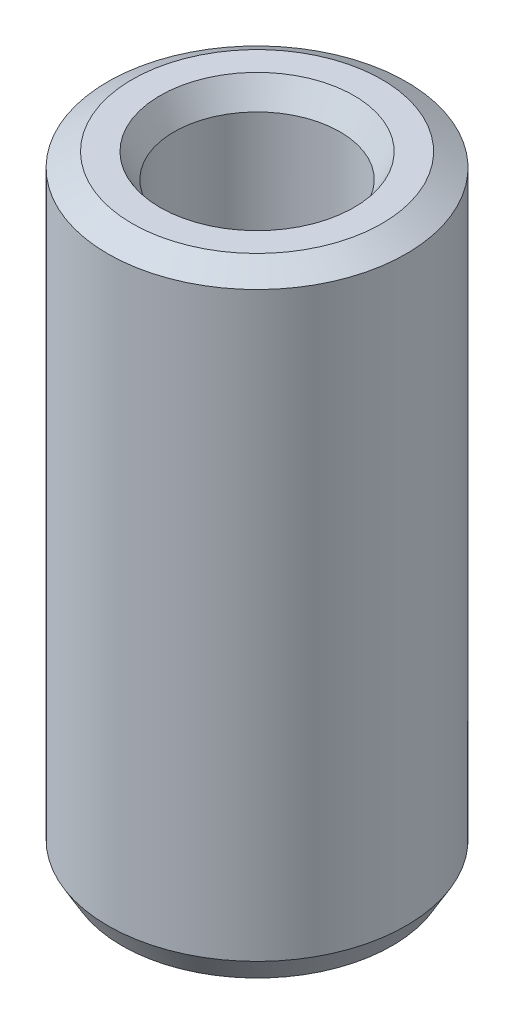
from build123d import *
from OCP.BRepFilletAPI import BRepFilletAPI_MakeChamfer

# Parameters (mm, degrees)
SKETCH1_R           = 5
BOSS_EXTRUDE1_DEPTH = 20.787715122
SKETCH2_R           = 2.77881358
CUT_EXTRUDE1_DEPTH  = 22.957438375
CHAMFER1_SIZE       = 0.470864407
CHAMFER1_SIZE2      = 0.815561076


with BuildPart() as part:
    # Sketch1 → Boss-Extrude1 (new body)
    with BuildSketch(Plane(origin=(0, 0, 0), x_dir=(1, 0, 0), z_dir=(0, 1, 0))):
        Circle(SKETCH1_R)
    extrude(amount=BOSS_EXTRUDE1_DEPTH)

    # Sketch2 → Cut-Extrude1 (cut, through all)
    with BuildSketch(Plane(origin=(0, 0, 0), x_dir=(1, 0, 0), z_dir=(0, 1, 0))):
        Circle(SKETCH2_R)
    extrude(amount=CUT_EXTRUDE1_DEPTH, mode=Mode.SUBTRACT)

    # Chamfer1: one chamfer whose edges measure the first distance from different faces: ONE call of the kernel's chamfer builder (chamfer() names one face for all edges)
    chamfer1_edges_1 = [part.edges().sort_by_distance(p)[0] for p in [
        (-2.77881358, 20.787715122, 0),
    ]]
    chamfer1_side_1 = [part.faces().sort_by_distance(p)[0] for p in [
        (-4.858578644, 20.787715122, 0),
    ]]
    chamfer1_edges_2 = [part.edges().sort_by_distance(p)[0] for p in [
        (-2.77881358, 0, 0),
    ]]
    chamfer1_side_2 = [part.faces().sort_by_distance(p)[0] for p in [
        (-2.77881358, 10.393857561, 0),
    ]]
    chamfer1_edges_3 = [part.edges().sort_by_distance(p)[0] for p in [
        (-5, 0, 0),
    ]]
    chamfer1_side_3 = [part.faces().sort_by_distance(p)[0] for p in [
        (-4.858578644, 0, 0),
    ]]
    chamfer1_edges_4 = [part.edges().sort_by_distance(p)[0] for p in [
        (-5, 20.787715122, 0),
    ]]
    chamfer1_side_4 = [part.faces().sort_by_distance(p)[0] for p in [
        (-5, 10.393857561, 0),
    ]]
    chamfer1 = BRepFilletAPI_MakeChamfer(part.part.solid().wrapped)
    for e in chamfer1_edges_1:
        chamfer1.Add(CHAMFER1_SIZE, CHAMFER1_SIZE2, e.wrapped, chamfer1_side_1[0].wrapped)  # the first distance lies on this face
    for e in chamfer1_edges_2:
        chamfer1.Add(CHAMFER1_SIZE, CHAMFER1_SIZE2, e.wrapped, chamfer1_side_2[0].wrapped)  # the first distance lies on this face
    for e in chamfer1_edges_3:
        chamfer1.Add(CHAMFER1_SIZE, CHAMFER1_SIZE2, e.wrapped, chamfer1_side_3[0].wrapped)  # the first distance lies on this face
    for e in chamfer1_edges_4:
        chamfer1.Add(CHAMFER1_SIZE, CHAMFER1_SIZE2, e.wrapped, chamfer1_side_4[0].wrapped)  # the first distance lies on this face
    add(Compound.cast(chamfer1.Shape()), mode=Mode.REPLACE)


solid = part.part
